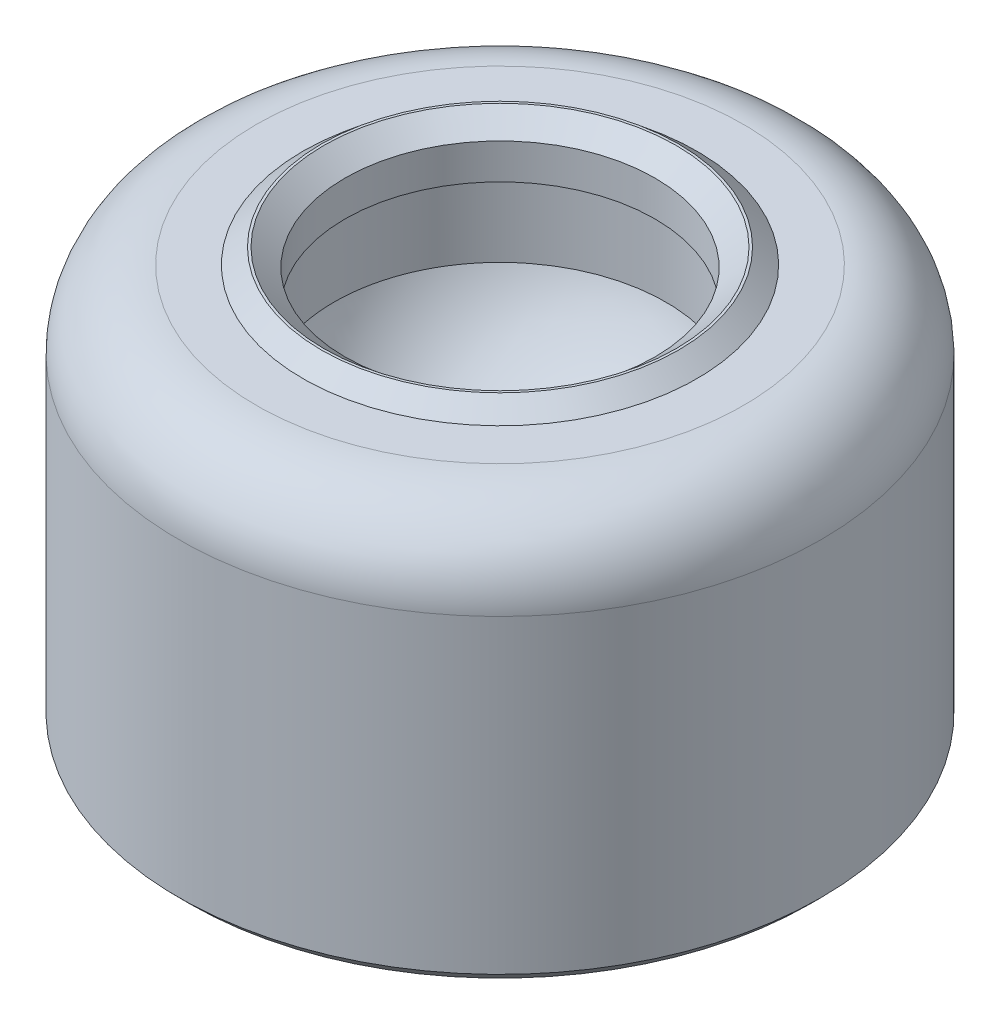
from build123d import *

# Parameters (mm, degrees)
SKETCH2_R                      = 8.9
BOSS_EXTRUDE1_DEPTH            = 0.7
BOSS_EXTRUDE1_TAPER            = 50
F_14_0_14_DIAMETER_HOLE1_D     = 14
F_14_0_14_DIAMETER_HOLE1_DEPTH = 2.4
SKETCH5_R                      = 10.232050808
BOSS_EXTRUDE2_DEPTH            = 2
CHAMFER1_SIZE                  = 0.5
CHAMFER2_SIZE                  = 0.953402874
CHAMFER2_SIZE2                 = 0.8
FILLET1_R                      = 1
FILLET2_R                      = 3.5


with BuildPart() as part:
    # Cut-Extrude1: read off the stored shape, not the designer's step
    # Cut-Extrude1 outline → Cut-Extrude1 (revolve)
    with BuildSketch(Plane.XY):
        with BuildLine():
            Line((0, 10.6), (0, 3))
            Line((0, 3), (14.5, 3))
            Line((14.5, 3), (14.5, 21))
            Line((14.5, 21), (0, 21))
            Line((0, 21), (0, 19.3))
            Line((0, 19.3), (7.493997598, 19.3))
            Line((7.493997598, 19.3), (7.493997598, 15.8))
            ThreePointArc((7.493997598, 15.8), (4.5607017, 12.02732931), (0, 10.6))
        make_face()
    revolve(axis=Axis((0, 0, 0), (0, 1, 0)))

    # Sketch2 → Boss-Extrude1 (add)
    with BuildSketch(Plane(origin=(0, 21, 0), x_dir=(-1, 0, 0), z_dir=(0, 1, 0))):
        Circle(SKETCH2_R)
    extrude(amount=BOSS_EXTRUDE1_DEPTH, taper=BOSS_EXTRUDE1_TAPER)

    # Ø14.0 (14) Diameter Hole1
    with Locations(Plane.XZ.offset(-19.3)):
        with Locations((0, 0)):
            Hole(F_14_0_14_DIAMETER_HOLE1_D / 2, depth=F_14_0_14_DIAMETER_HOLE1_DEPTH)

    # Sketch5 → Boss-Extrude2 (add)
    with BuildSketch(Plane.XZ.offset(-3)):
        Circle(SKETCH5_R)
    extrude(amount=BOSS_EXTRUDE2_DEPTH)

    # Chamfer1
    chamfer1_edges = [part.edges().sort_by_distance(p)[0] for p in [
        (-14.5, 3, 0),
    ]]
    chamfer(chamfer1_edges, length=CHAMFER1_SIZE)

    # Chamfer2
    chamfer2_edges = [part.edges().sort_by_distance(p)[0] for p in [
        (7, 21.7, 0),
    ]]
    chamfer2_side = [part.faces().sort_by_distance(p)[0] for p in [
        (7.837637988, 21.7, 0),
    ]]
    chamfer(chamfer2_edges, length=CHAMFER2_SIZE, length2=CHAMFER2_SIZE2, reference=chamfer2_side[0])

    # Fillet1
    fillet1_edges = [part.edges().sort_by_distance(p)[0] for p in [
        (-10.232050808, 1, 0),
    ]]
    fillet(fillet1_edges, radius=FILLET1_R)

    # Fillet2
    fillet2_edges = [part.edges().sort_by_distance(p)[0] for p in [
        (-14.5, 21, 0),
    ]]
    fillet(fillet2_edges, radius=FILLET2_R)


solid = part.part
